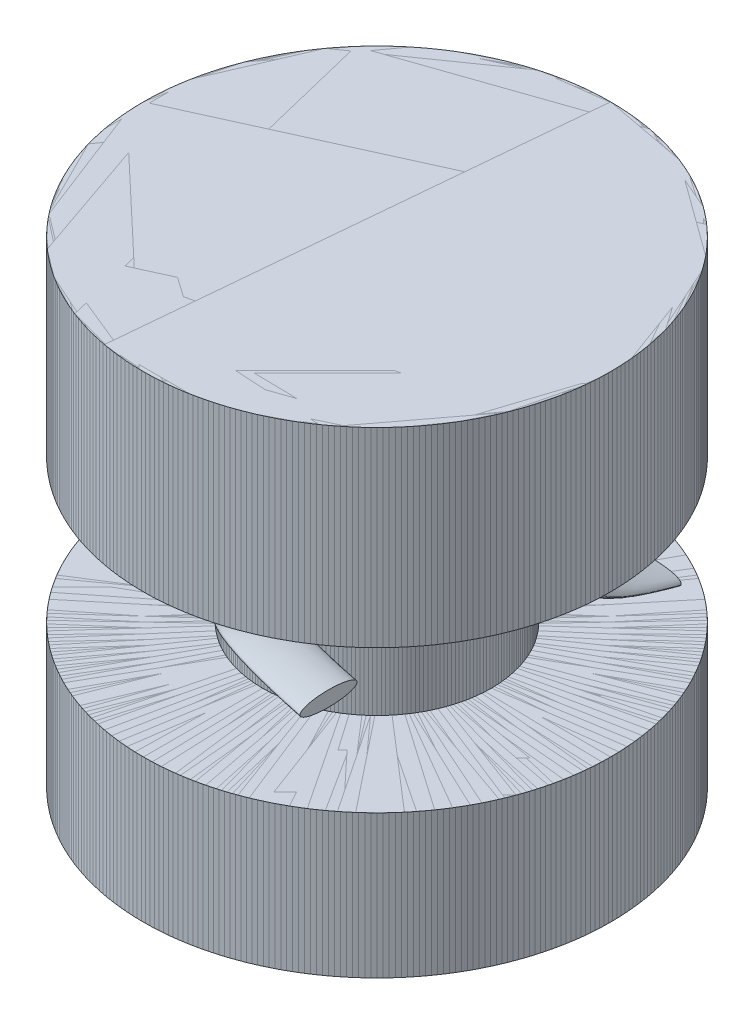
from build123d import *

# Parameters (mm, degrees)
SKETCH4_RX         = 0.762
SKETCH4_RY         = 0.2032
MOAR_SPRINGS_COUNT = 4


with BuildPart() as part:
    # Sketch1 → button body (revolve)
    with BuildSketch(Plane.XY):
        Polygon((0, 0), (6.223, 0), (6.223, -5.08), (3.048, -5.08), (3.048, -8.89), (6.223, -8.89), (6.223, -12.7), (0, -12.7), align=None)
    revolve(axis=Axis((0, -12.7, 0), (0, 1, 0)))

    # spring: sweep along a path in Sketch2
    with BuildLine() as spring_path:  # in the path sketch's own coordinates; laid on its plane below (add() does not lay a ready-made edge on the line's plane)
        add(Edge.make_bspline(
            [(2.954214398, -4.563042373), (1.853840829, -5.273927005), (-1.483890647, -5.778615601), (3.024167345, -6.982669911)],
            knots=[0, 0, 0, 0, 1, 1, 1, 1], degree=3))
    # Sketch4 → spring (sweep)
    with BuildSketch(Plane.XY.offset(-3.024167345)):
        with Locations(Location((4.318, -6.982669911), (0, 0, 180))):
            Ellipse(SKETCH4_RX, SKETCH4_RY)
    sweep(path=Plane(origin=(4.318, 0, 0), x_dir=(0, 0, -1), z_dir=(1, 0, 0)) * spring_path.line)


with BuildPart() as moar_springs_1:
    # moar springs: pattern copy
    add(part.part.rotate(Axis((0, 0, 0), (0, -1, 0)), 1 * 360 / MOAR_SPRINGS_COUNT))


with BuildPart() as moar_springs_2:
    # moar springs: pattern copy
    add(part.part.rotate(Axis((0, 0, 0), (0, -1, 0)), 2 * 360 / MOAR_SPRINGS_COUNT))


with BuildPart() as moar_springs_3:
    # moar springs: pattern copy
    add(part.part.rotate(Axis((0, 0, 0), (0, -1, 0)), 3 * 360 / MOAR_SPRINGS_COUNT))


solid = Compound([part.part, moar_springs_1.part, moar_springs_2.part, moar_springs_3.part])
